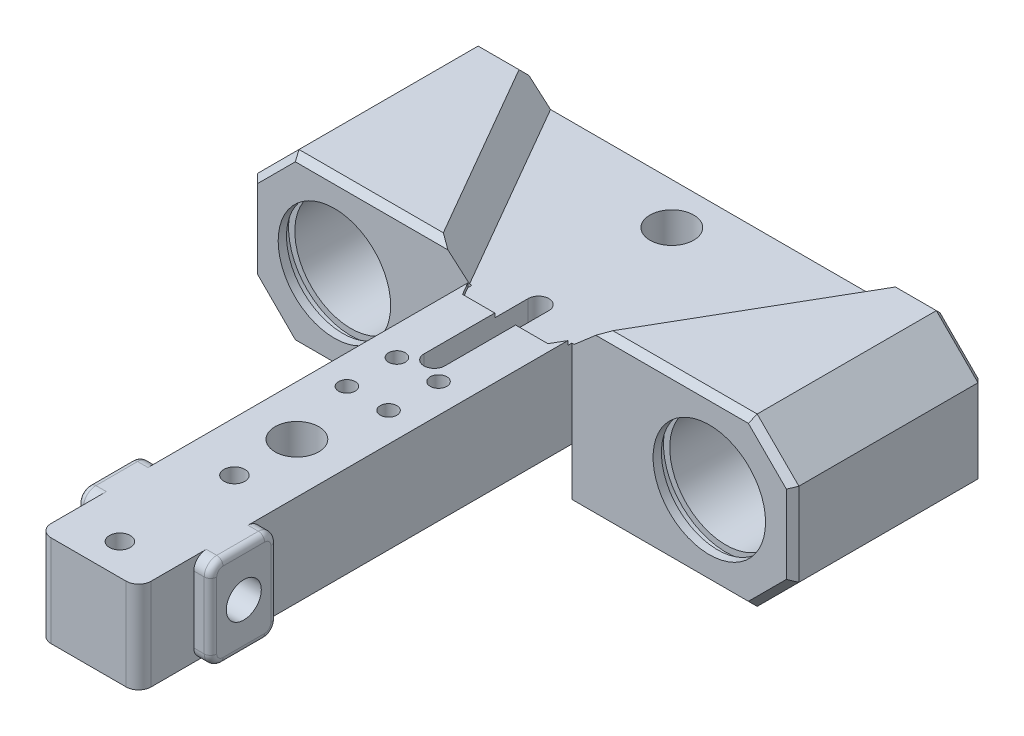
from build123d import *

# Parameters (mm, degrees)
SKETCH1_W           = 130
SKETCH1_H           = 40
BOSS_EXTRUDE1_DEPTH = 125
SKETCH2_R           = 13.5
CUT_EXTRUDE1_DEPTH  = 130
SKETCH3_W           = 24
SKETCH3_H           = 13
CUT_EXTRUDE2_DEPTH  = 125
SKETCH4_W           = 20.5
SKETCH4_H           = 5
CUT_EXTRUDE3_DEPTH  = 125
SKETCH5_R           = 2.75
CUT_EXTRUDE4_DEPTH  = 40
SKETCH6_R           = 2
CUT_EXTRUDE5_DEPTH  = 40
SKETCH7_R           = 5.25
CUT_EXTRUDE6_DEPTH  = 15
CUT_EXTRUDE11_START = -4
SKETCH10_R          = 15
SKETCH10_R_2        = 13.5
CUT_EXTRUDE11_DEPTH = 2
CHAMFER1_SIZE       = 10
CUT_EXTRUDE13_DEPTH = 79
CUT_EXTRUDE14_START = -2
SKETCH13_R          = 15
SKETCH13_R_2        = 13.5
CUT_EXTRUDE14_DEPTH = 2
CUT_EXTRUDE16_DEPTH = 6
CHAMFER2_SIZE       = 6
CHAMFER3_SIZE       = 1.5
CHAMFER4_SIZE       = 1.5
SKETCH16_W          = 24
SKETCH16_H          = 22
BOSS_EXTRUDE2_DEPTH = 25
SKETCH17_R          = 2.5
CUT_EXTRUDE17_DEPTH = 25
FILLET2_R           = 3
SKETCH18_W          = 32
SKETCH18_H          = 16
BOSS_EXTRUDE3_DEPTH = 22
SKETCH19_R          = 4.2
CUT_EXTRUDE18_DEPTH = 40
FILLET3_R           = 3
FILLET4_R           = 1.5
SKETCH20_R          = 5.75
CUT_EXTRUDE19_DEPTH = 11


with BuildPart() as part:
    # Sketch1 → Boss-Extrude1 (new body)
    with BuildSketch(Plane.XY):
        Rectangle(SKETCH1_W, SKETCH1_H)
    extrude(amount=BOSS_EXTRUDE1_DEPTH)

    # Sketch2 → Cut-Extrude1 (cut)
    with BuildSketch(Plane.XY.offset(125)):
        with Locations((-45, 0)):
            Circle(SKETCH2_R)
        with Locations((45, 0)):
            Circle(SKETCH2_R)
    extrude(amount=-CUT_EXTRUDE1_DEPTH, mode=Mode.SUBTRACT)

    # Sketch3 → Cut-Extrude2 (cut)
    with BuildSketch(Plane.XY.offset(125)):
        with Locations((0, -13.5)):
            Rectangle(SKETCH3_W, SKETCH3_H)
    extrude(amount=-CUT_EXTRUDE2_DEPTH, mode=Mode.SUBTRACT)

    # Sketch4 → Cut-Extrude3 (cut)
    with BuildSketch(Plane.XY.offset(125)):
        with Locations((0, 17.5)):
            Rectangle(SKETCH4_W, SKETCH4_H)
    extrude(amount=-CUT_EXTRUDE3_DEPTH, mode=Mode.SUBTRACT)

    # Sketch5 → Cut-Extrude4 (cut)
    with BuildSketch(Plane(origin=(0, 15, 0), x_dir=(1, 0, 0), z_dir=(0, 1, 0))):
        with Locations(Location((0, -10, 0), (0, 0, 270))):
            Circle(SKETCH5_R)
        with Locations(Location((0, -100, 0), (0, 0, 270))):
            Circle(SKETCH5_R)
    extrude(amount=-CUT_EXTRUDE4_DEPTH, mode=Mode.SUBTRACT)

    # Sketch6 → Cut-Extrude5 (cut)
    with BuildSketch(Plane(origin=(0, 15, 0), x_dir=(1, 0, 0), z_dir=(0, 1, 0))):
        with Locations(Location((-5, -71, 0), (0, 0, 270))):
            Circle(SKETCH6_R)
        with Locations(Location((5, -71, 0), (0, 0, 270))):
            Circle(SKETCH6_R)
        with Locations(Location((5, -83, 0), (0, 0, 270))):
            Circle(SKETCH6_R)
        with Locations(Location((-5, -83, 0), (0, 0, 270))):
            Circle(SKETCH6_R)
        with BuildLine():
            Line((2.5, -42), (2.5, -67))
            ThreePointArc((2.5, -67), (0, -69.5), (-2.5, -67))
            Line((-2.5, -67), (-2.5, -42))
            ThreePointArc((-2.5, -42), (0, -39.5), (2.5, -42))
        make_face()
    extrude(amount=-CUT_EXTRUDE5_DEPTH, mode=Mode.SUBTRACT)

    # Sketch7 → Cut-Extrude6 (cut)
    with BuildSketch(Plane(origin=(0, 15, 0), x_dir=(1, 0, 0), z_dir=(0, 1, 0))):
        with Locations(Location((0, -100, 0), (0, 0, 270))):
            Circle(SKETCH7_R)
        with Locations(Location((0, -10, 0), (0, 0, 270))):
            Circle(SKETCH7_R)
    extrude(amount=-CUT_EXTRUDE6_DEPTH, mode=Mode.SUBTRACT)

    # Sketch10 → Cut-Extrude11 (cut)
    # profile 1 of 2: a face of its own
    with BuildSketch(Plane(origin=(0, 0, 0), x_dir=(-1, 0, 0), z_dir=(0, 0, -1)).offset(CUT_EXTRUDE11_START)):
        with Locations((-45, 0)):
            Circle(SKETCH10_R)
        with Locations(Location((-45, 0, 0), (0, 0, 180))):
            Circle(SKETCH10_R_2, mode=Mode.SUBTRACT)
    # profile 2 of 2: a face of its own
    with BuildSketch(Plane(origin=(0, 0, 0), x_dir=(-1, 0, 0), z_dir=(0, 0, -1)).offset(CUT_EXTRUDE11_START)):
        with Locations((45, 0)):
            Circle(SKETCH10_R)
        with Locations(Location((45, 0, 0), (0, 0, 180))):
            Circle(SKETCH10_R_2, mode=Mode.SUBTRACT)
    extrude(amount=CUT_EXTRUDE11_DEPTH, mode=Mode.SUBTRACT)

    # Chamfer1
    chamfer1_edges = [part.edges().sort_by_distance(p)[0] for p in [
        (65, -20, 62.5),
        (-65, -20, 62.5),
        (-65, 20, 62.5),
        (65, 20, 62.5),
    ]]
    chamfer(chamfer1_edges, length=CHAMFER1_SIZE)

    # Sketch12 → Cut-Extrude13 (cut)
    with BuildSketch(Plane.XY.offset(125)):
        Polygon((-12, -7), (-12, 15), (-10.25, 15), (-10.25, 20), (-55, 20), (-65, 10), (-65, -10), (-55, -20), (-12, -20), align=None)
        Polygon((12, -7), (12, 15), (10.25, 15), (10.25, 20), (55, 20), (65, 10), (65, -10), (55, -20), (12, -20), align=None)
    extrude(amount=-CUT_EXTRUDE13_DEPTH, mode=Mode.SUBTRACT)

    # Sketch13 → Cut-Extrude14 (cut)
    # profile 1 of 2: a face of its own
    with BuildSketch(Plane.XY.offset(46).offset(CUT_EXTRUDE14_START)):
        with Locations(Location((-45, 0, 0), (0, 0, 180))):
            Circle(SKETCH13_R)
        with Locations((-45, 0)):
            Circle(SKETCH13_R_2, mode=Mode.SUBTRACT)
    # profile 2 of 2: a face of its own
    with BuildSketch(Plane.XY.offset(46).offset(CUT_EXTRUDE14_START)):
        with Locations(Location((45, 0, 0), (0, 0, 180))):
            Circle(SKETCH13_R)
        with Locations((45, 0)):
            Circle(SKETCH13_R_2, mode=Mode.SUBTRACT)
    extrude(amount=-CUT_EXTRUDE14_DEPTH, mode=Mode.SUBTRACT)

    # Sketch14 → Cut-Extrude16 (cut)
    with BuildSketch(Plane(origin=(0, 20, 0), x_dir=(1, 0, 0), z_dir=(0, 1, 0))):
        Polygon((-10.25, -50), (10.25, -50), (39.117513459, 0), (10.25, 0), (-10.25, 0), (-39.117513459, 0), align=None)
    extrude(amount=-CUT_EXTRUDE16_DEPTH, mode=Mode.SUBTRACT)

    # Chamfer2
    chamfer2_edges = [part.edges().sort_by_distance(p)[0] for p in [
        (-25.838457268, 20, 23),
        (25.838457268, 20, 23),
    ]]
    chamfer(chamfer2_edges, length=CHAMFER2_SIZE - 0.0001)  # a hair under: the kernel refuses the full size

    # Chamfer3
    chamfer3_edges = [part.edges().sort_by_distance(p)[0] for p in [
        (-33.5, -20, 46),
        (-60, -15, 46),
        (-65, 0, 46),
        (-60, 15, 46),
        (37.243744418, 20, 46),
        (60, 15, 46),
        (65, 0, 46),
        (60, -15, 46),
        (33.5, -20, 46),
        (-37.243744418, 20, 46),
    ]]
    chamfer(chamfer3_edges, length=CHAMFER3_SIZE)

    # Chamfer4
    chamfer4_edges = [part.edges().sort_by_distance(p)[0] for p in [
        (65, 0, 0),
        (50.52280061, 20, 0),
        (-33.5, -20, 0),
        (-65, 0, 0),
        (-60, 15, 0),
        (-60, -15, 0),
        (60, 15, 0),
        (60, -15, 0),
        (33.5, -20, 0),
        (-50.52280061, 20, 0),
    ]]
    chamfer(chamfer4_edges, length=CHAMFER4_SIZE)

    # Sketch16 → Boss-Extrude2 (add)
    with BuildSketch(Plane.XY.offset(125)):
        with Locations((0, 4)):
            Rectangle(SKETCH16_W, SKETCH16_H)
    extrude(amount=BOSS_EXTRUDE2_DEPTH)

    # Sketch17 → Cut-Extrude17 (cut)
    with BuildSketch(Plane(origin=(0, 15, 0), x_dir=(1, 0, 0), z_dir=(0, 1, 0))):
        with Locations(Location((0, -142.5, 0), (0, 0, 270))):
            Circle(SKETCH17_R)
        with Locations(Location((0, -115, 0), (0, 0, 270))):
            Circle(SKETCH17_R)
    extrude(amount=-CUT_EXTRUDE17_DEPTH, mode=Mode.SUBTRACT)

    # Fillet2
    fillet2_edges = [part.edges().sort_by_distance(p)[0] for p in [
        (12, 4, 150),
        (-12, 4, 150),
    ]]
    fillet(fillet2_edges, radius=FILLET2_R)

    # Sketch18 → Boss-Extrude3 (add)
    with BuildSketch(Plane(origin=(0, 15, 0), x_dir=(1, 0, 0), z_dir=(0, 1, 0))):
        with Locations((0, -128.75)):
            Rectangle(SKETCH18_W, SKETCH18_H)
    extrude(amount=-BOSS_EXTRUDE3_DEPTH)

    # Sketch19 → Cut-Extrude18 (cut)
    with BuildSketch(Plane.ZY.offset(16)):
        with Locations((128.75, 4)):
            Circle(SKETCH19_R)
    extrude(amount=-CUT_EXTRUDE18_DEPTH, mode=Mode.SUBTRACT)

    # Fillet3
    fillet3_edges = [part.edges().sort_by_distance(p)[0] for p in [
        (-14, -7, 120.75),
        (14, -7, 120.75),
        (-14, -7, 136.75),
        (14, -7, 136.75),
        (-14, 15, 120.75),
        (-14, 15, 136.75),
        (14, 15, 136.75),
        (14, 15, 120.75),
    ]]
    fillet(fillet3_edges, radius=FILLET3_R)

    # Fillet4
    fillet4_edges = [part.edges().sort_by_distance(p)[0] for p in [
        (16, 4, 120.75),
        (-16, -7, 128.75),
        (16, -7, 128.75),
        (16, 15, 128.75),
        (16, 4, 136.75),
        (16, 14.121320344, 121.628679656),
        (16, 14.121320344, 135.871320344),
        (16, -6.121320344, 135.871320344),
        (16, -6.121320344, 121.628679656),
        (-16, 4, 136.75),
        (-16, 15, 128.75),
        (-16, 4, 120.75),
        (-16, 14.121320344, 121.628679656),
        (-16, 14.121320344, 135.871320344),
        (-16, -6.121320344, 121.628679656),
        (-16, -6.121320344, 135.871320344),
    ]]
    fillet(fillet4_edges, radius=FILLET4_R)

    # Sketch20 → Cut-Extrude19 (cut)
    with BuildSketch(Plane.ZY.offset(16)):
        with Locations((128.75, 4)):
            Circle(SKETCH20_R)
    extrude(amount=-CUT_EXTRUDE19_DEPTH, mode=Mode.SUBTRACT)


solid = part.part
